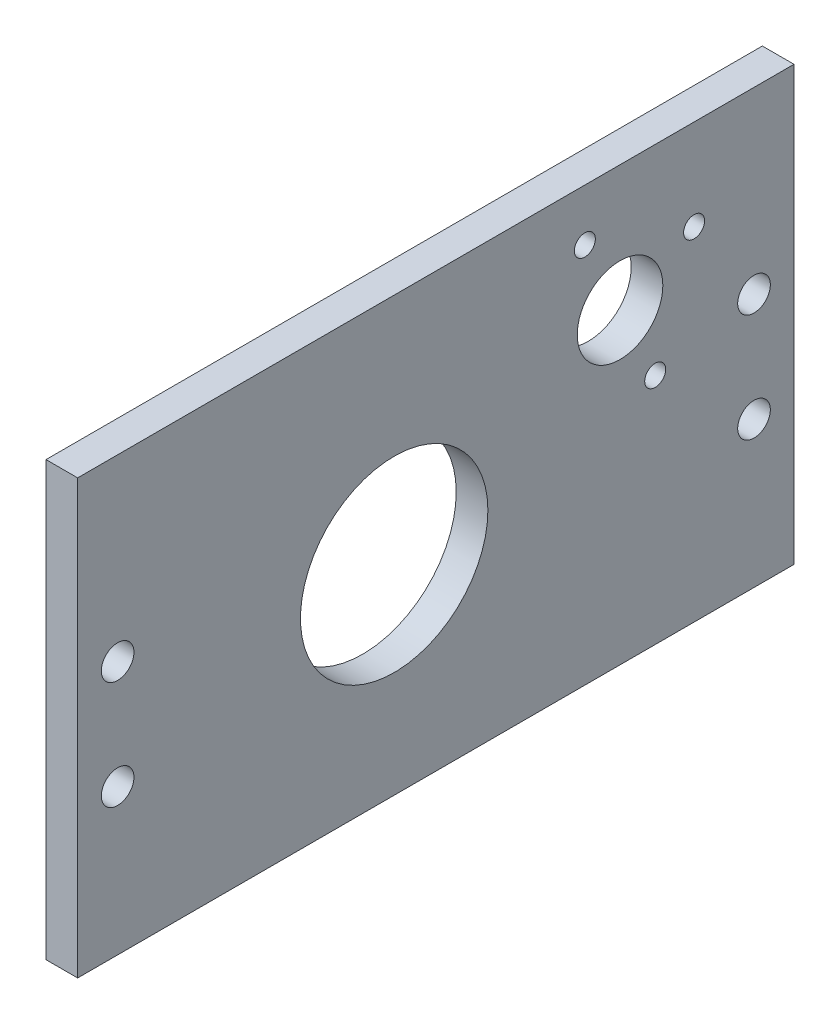
from build123d import *

# Parameters (mm, degrees)
SKETCH2_W            = 109.22
SKETCH2_H            = 66.04
SKETCH2_R            = 14.2875
SKETCH2_R_2          = 6.525
SKETCH2_R_3          = 2.4892
BOSS_EXTRUDE1_DEPTH  = 4.826
M3_CLEARANCE_HOLE1_D = 3.2


with BuildPart() as part:
    # Sketch2 → Boss-Extrude1 (new body)
    with BuildSketch(Plane(origin=(0, 0, 0), x_dir=(0, 0, -1), z_dir=(1, 0, 0))):
        with Locations((6.35, 2.54)):
            Rectangle(SKETCH2_W, SKETCH2_H)
        Circle(SKETCH2_R, mode=Mode.SUBTRACT)
        with Locations((34.436608399, 16.360505101)):
            Circle(SKETCH2_R_2, mode=Mode.SUBTRACT)
        with Locations((54.864, 8.255)):
            Circle(SKETCH2_R_3, mode=Mode.SUBTRACT)
        with Locations((54.864, -8.255)):
            Circle(SKETCH2_R_3, mode=Mode.SUBTRACT)
        with Locations((-42.164, 8.255)):
            Circle(SKETCH2_R_3, mode=Mode.SUBTRACT)
        with Locations((-42.164, -8.255)):
            Circle(SKETCH2_R_3, mode=Mode.SUBTRACT)
    extrude(amount=-BOSS_EXTRUDE1_DEPTH)

    # M3 Clearance Hole1 (through all)
    with Locations(Plane(origin=(0, 0, 0), x_dir=(0, 0, -1), z_dir=(1, 0, 0))):
        with Locations((39.800652153, 5.069932281), (29.072564644, 27.65107792), (45.727181219, 21.724548855)):
            Hole(M3_CLEARANCE_HOLE1_D / 2)


solid = part.part
